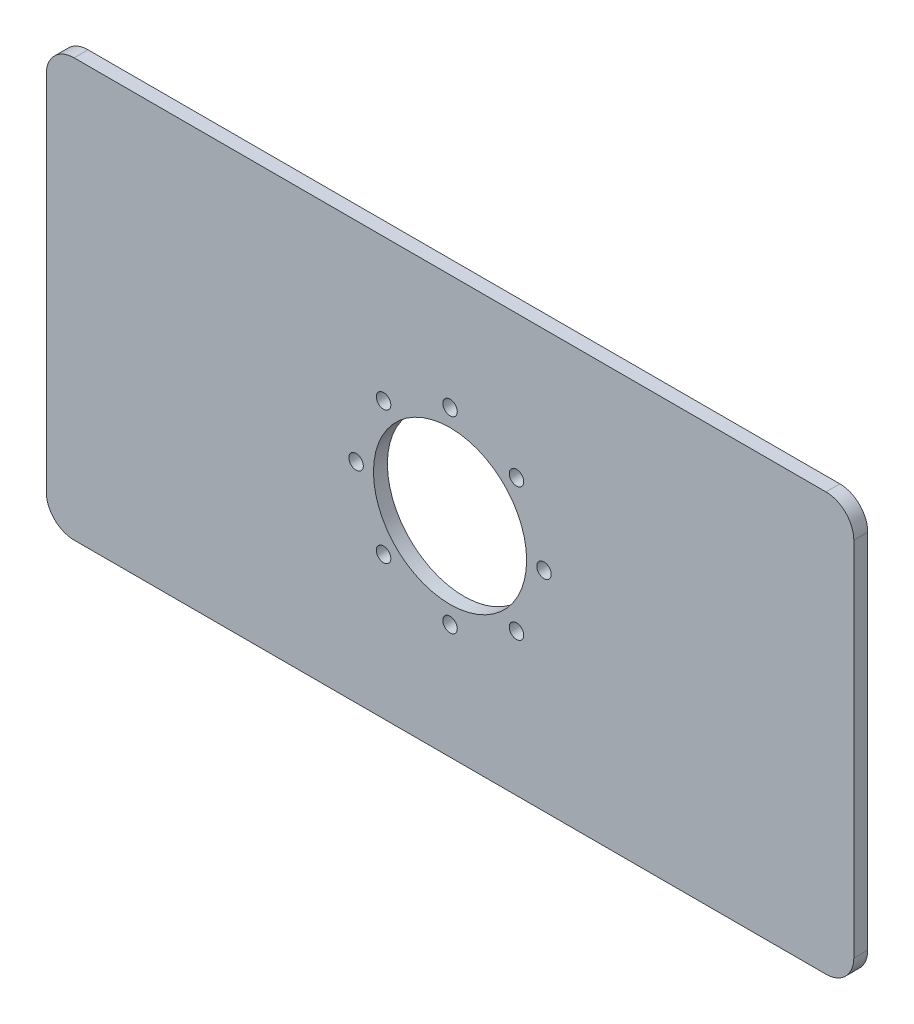
from build123d import *

# Parameters (mm, degrees)
SKETCH_1_W          = 290
SKETCH_1_H          = 150
EXTRUDE_1_DEPTH     = 5
CUT_EXTRUDE_2_REACH = 165.325
SKETCH_5_R          = 27.5
SKETCH_5_R_2        = 2.6
FILLET_1_R          = 10


with BuildPart() as part:
    # 草图1 → 凸台-拉伸1 (new body)
    with BuildSketch(Plane.XY):
        Rectangle(SKETCH_1_W, SKETCH_1_H)
    extrude(amount=EXTRUDE_1_DEPTH)

    # 草图5 → 切除-拉伸2 (cut, up to next)
    with BuildSketch(Plane(origin=(0, 0, 0), x_dir=(-1, 0, 0), z_dir=(0, 0, -1)), mode=Mode.PRIVATE) as cut_extrude_2_sk1:
        Circle(SKETCH_5_R)
    cut_extrude_2_tool1 = extrude(cut_extrude_2_sk1.sketch, amount=-CUT_EXTRUDE_2_REACH, mode=Mode.PRIVATE) & part.part
    # 草图5 → 切除-拉伸2 (cut, up to next)
    with BuildSketch(Plane(origin=(0, 0, 0), x_dir=(-1, 0, 0), z_dir=(0, 0, -1)), mode=Mode.PRIVATE) as cut_extrude_2_sk2:
        with Locations((23.864853865, 23.864853865)):
            Circle(SKETCH_5_R_2)
    cut_extrude_2_tool2 = extrude(cut_extrude_2_sk2.sketch, amount=-CUT_EXTRUDE_2_REACH, mode=Mode.PRIVATE) & part.part
    # 草图5 → 切除-拉伸2 (cut, up to next)
    with BuildSketch(Plane(origin=(0, 0, 0), x_dir=(-1, 0, 0), z_dir=(0, 0, -1)), mode=Mode.PRIVATE) as cut_extrude_2_sk3:
        with Locations((0, 33.75)):
            Circle(SKETCH_5_R_2)
    cut_extrude_2_tool3 = extrude(cut_extrude_2_sk3.sketch, amount=-CUT_EXTRUDE_2_REACH, mode=Mode.PRIVATE) & part.part
    # 草图5 → 切除-拉伸2 (cut, up to next)
    with BuildSketch(Plane(origin=(0, 0, 0), x_dir=(-1, 0, 0), z_dir=(0, 0, -1)), mode=Mode.PRIVATE) as cut_extrude_2_sk4:
        with Locations((-23.864853865, 23.864853865)):
            Circle(SKETCH_5_R_2)
    cut_extrude_2_tool4 = extrude(cut_extrude_2_sk4.sketch, amount=-CUT_EXTRUDE_2_REACH, mode=Mode.PRIVATE) & part.part
    # 草图5 → 切除-拉伸2 (cut, up to next)
    with BuildSketch(Plane(origin=(0, 0, 0), x_dir=(-1, 0, 0), z_dir=(0, 0, -1)), mode=Mode.PRIVATE) as cut_extrude_2_sk5:
        with Locations((-33.75, 0)):
            Circle(SKETCH_5_R_2)
    cut_extrude_2_tool5 = extrude(cut_extrude_2_sk5.sketch, amount=-CUT_EXTRUDE_2_REACH, mode=Mode.PRIVATE) & part.part
    # 草图5 → 切除-拉伸2 (cut, up to next)
    with BuildSketch(Plane(origin=(0, 0, 0), x_dir=(-1, 0, 0), z_dir=(0, 0, -1)), mode=Mode.PRIVATE) as cut_extrude_2_sk6:
        with Locations((-23.864853865, -23.864853865)):
            Circle(SKETCH_5_R_2)
    cut_extrude_2_tool6 = extrude(cut_extrude_2_sk6.sketch, amount=-CUT_EXTRUDE_2_REACH, mode=Mode.PRIVATE) & part.part
    # 草图5 → 切除-拉伸2 (cut, up to next)
    with BuildSketch(Plane(origin=(0, 0, 0), x_dir=(-1, 0, 0), z_dir=(0, 0, -1)), mode=Mode.PRIVATE) as cut_extrude_2_sk7:
        with Locations((0, -33.75)):
            Circle(SKETCH_5_R_2)
    cut_extrude_2_tool7 = extrude(cut_extrude_2_sk7.sketch, amount=-CUT_EXTRUDE_2_REACH, mode=Mode.PRIVATE) & part.part
    # 草图5 → 切除-拉伸2 (cut, up to next)
    with BuildSketch(Plane(origin=(0, 0, 0), x_dir=(-1, 0, 0), z_dir=(0, 0, -1)), mode=Mode.PRIVATE) as cut_extrude_2_sk8:
        with Locations((23.864853865, -23.864853865)):
            Circle(SKETCH_5_R_2)
    cut_extrude_2_tool8 = extrude(cut_extrude_2_sk8.sketch, amount=-CUT_EXTRUDE_2_REACH, mode=Mode.PRIVATE) & part.part
    # 草图5 → 切除-拉伸2 (cut, up to next)
    with BuildSketch(Plane(origin=(0, 0, 0), x_dir=(-1, 0, 0), z_dir=(0, 0, -1)), mode=Mode.PRIVATE) as cut_extrude_2_sk9:
        with Locations((33.75, 0)):
            Circle(SKETCH_5_R_2)
    cut_extrude_2_tool9 = extrude(cut_extrude_2_sk9.sketch, amount=-CUT_EXTRUDE_2_REACH, mode=Mode.PRIVATE) & part.part
    add(cut_extrude_2_tool1.solids().sort_by_distance((0, 0, 0))[0], mode=Mode.SUBTRACT)
    add(cut_extrude_2_tool2.solids().sort_by_distance((-23.864854, 23.864854, 0))[0], mode=Mode.SUBTRACT)
    add(cut_extrude_2_tool3.solids().sort_by_distance((0, 33.75, 0))[0], mode=Mode.SUBTRACT)
    add(cut_extrude_2_tool4.solids().sort_by_distance((23.864854, 23.864854, 0))[0], mode=Mode.SUBTRACT)
    add(cut_extrude_2_tool5.solids().sort_by_distance((33.75, 0, 0))[0], mode=Mode.SUBTRACT)
    add(cut_extrude_2_tool6.solids().sort_by_distance((23.864854, -23.864854, 0))[0], mode=Mode.SUBTRACT)
    add(cut_extrude_2_tool7.solids().sort_by_distance((0, -33.75, 0))[0], mode=Mode.SUBTRACT)
    add(cut_extrude_2_tool8.solids().sort_by_distance((-23.864854, -23.864854, 0))[0], mode=Mode.SUBTRACT)
    add(cut_extrude_2_tool9.solids().sort_by_distance((-33.75, 0, 0))[0], mode=Mode.SUBTRACT)

    # 圆角1
    fillet_1_edges = [part.edges().sort_by_distance(p)[0] for p in [
        (145, 75, 2.5),
        (145, -75, 2.5),
        (-145, -75, 2.5),
        (-145, 75, 2.5),
    ]]
    fillet(fillet_1_edges, radius=FILLET_1_R)


solid = part.part
